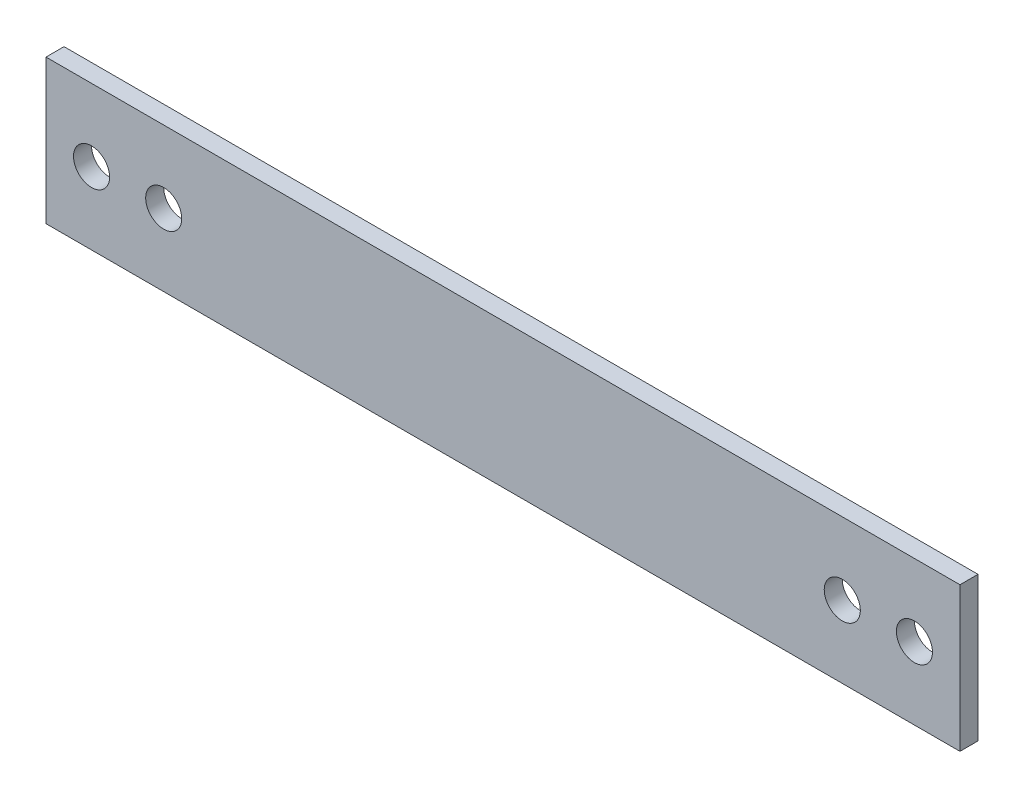
from build123d import *

# Parameters (mm, degrees)
SKETCH1_W           = 241.3
SKETCH1_H           = 38.1
SKETCH1_R           = 4.7625
BOSS_EXTRUDE1_DEPTH = 4.7625


with BuildPart() as part:
    # Sketch1 → Boss-Extrude1 (new body)
    with BuildSketch(Plane.XY):
        Rectangle(SKETCH1_W, SKETCH1_H)
        with Locations((-108.625531915, 0)):
            Circle(SKETCH1_R, mode=Mode.SUBTRACT)
        with Locations((-89.575531915, 0)):
            Circle(SKETCH1_R, mode=Mode.SUBTRACT)
        with Locations((89.575531915, 0)):
            Circle(SKETCH1_R, mode=Mode.SUBTRACT)
        with Locations((108.625531915, 0)):
            Circle(SKETCH1_R, mode=Mode.SUBTRACT)
    extrude(amount=BOSS_EXTRUDE1_DEPTH)


solid = part.part
